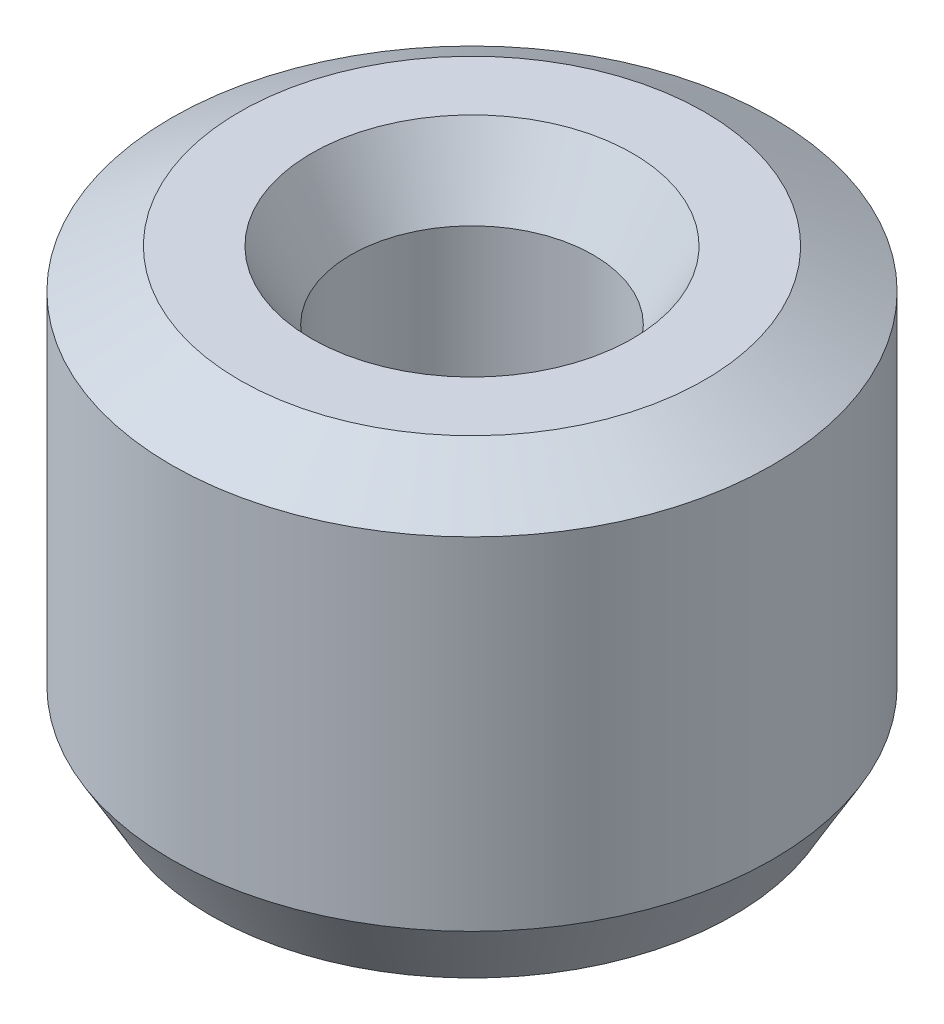
from build123d import *
from OCP.BRepFilletAPI import BRepFilletAPI_MakeChamfer

# Parameters (mm, degrees)
SKETCH1_R           = 17.5
BOSS_EXTRUDE1_DEPTH = 26.152556263
SKETCH2_R           = 7.053677075
CUT_EXTRUDE1_DEPTH  = 37.006335541
CHAMFER1_SIZE       = 2.29323165
CHAMFER1_SIZE2      = 3.971993731


with BuildPart() as part:
    # Sketch1 → Boss-Extrude1 (new body)
    with BuildSketch(Plane(origin=(0, 0, 0), x_dir=(1, 0, 0), z_dir=(0, 1, 0))):
        Circle(SKETCH1_R)
    extrude(amount=BOSS_EXTRUDE1_DEPTH)

    # Sketch2 → Cut-Extrude1 (cut, through all)
    with BuildSketch(Plane(origin=(0, 0, 0), x_dir=(1, 0, 0), z_dir=(0, 1, 0))):
        Circle(SKETCH2_R)
    extrude(amount=CUT_EXTRUDE1_DEPTH, mode=Mode.SUBTRACT)

    # Chamfer1: one chamfer whose edges measure the first distance from different faces: ONE call of the kernel's chamfer builder (chamfer() names one face for all edges)
    chamfer1_edges_1 = [part.edges().sort_by_distance(p)[0] for p in [
        (-7.053677075, 26.152556263, 0),
    ]]
    chamfer1_side_1 = [part.faces().sort_by_distance(p)[0] for p in [
        (-17.005025253, 26.152556263, 0),
    ]]
    chamfer1_edges_2 = [part.edges().sort_by_distance(p)[0] for p in [
        (-7.053677075, 0, 0),
    ]]
    chamfer1_side_2 = [part.faces().sort_by_distance(p)[0] for p in [
        (-7.053677075, 13.076278131, 0),
    ]]
    chamfer1_edges_3 = [part.edges().sort_by_distance(p)[0] for p in [
        (-17.5, 0, 0),
    ]]
    chamfer1_side_3 = [part.faces().sort_by_distance(p)[0] for p in [
        (-17.005025253, 0, 0),
    ]]
    chamfer1_edges_4 = [part.edges().sort_by_distance(p)[0] for p in [
        (-17.5, 26.152556263, 0),
    ]]
    chamfer1_side_4 = [part.faces().sort_by_distance(p)[0] for p in [
        (-17.5, 13.076278131, 0),
    ]]
    chamfer1 = BRepFilletAPI_MakeChamfer(part.part.solid().wrapped)
    for e in chamfer1_edges_1:
        chamfer1.Add(CHAMFER1_SIZE, CHAMFER1_SIZE2, e.wrapped, chamfer1_side_1[0].wrapped)  # the first distance lies on this face
    for e in chamfer1_edges_2:
        chamfer1.Add(CHAMFER1_SIZE, CHAMFER1_SIZE2, e.wrapped, chamfer1_side_2[0].wrapped)  # the first distance lies on this face
    for e in chamfer1_edges_3:
        chamfer1.Add(CHAMFER1_SIZE, CHAMFER1_SIZE2, e.wrapped, chamfer1_side_3[0].wrapped)  # the first distance lies on this face
    for e in chamfer1_edges_4:
        chamfer1.Add(CHAMFER1_SIZE, CHAMFER1_SIZE2, e.wrapped, chamfer1_side_4[0].wrapped)  # the first distance lies on this face
    add(Compound.cast(chamfer1.Shape()), mode=Mode.REPLACE)


solid = part.part
